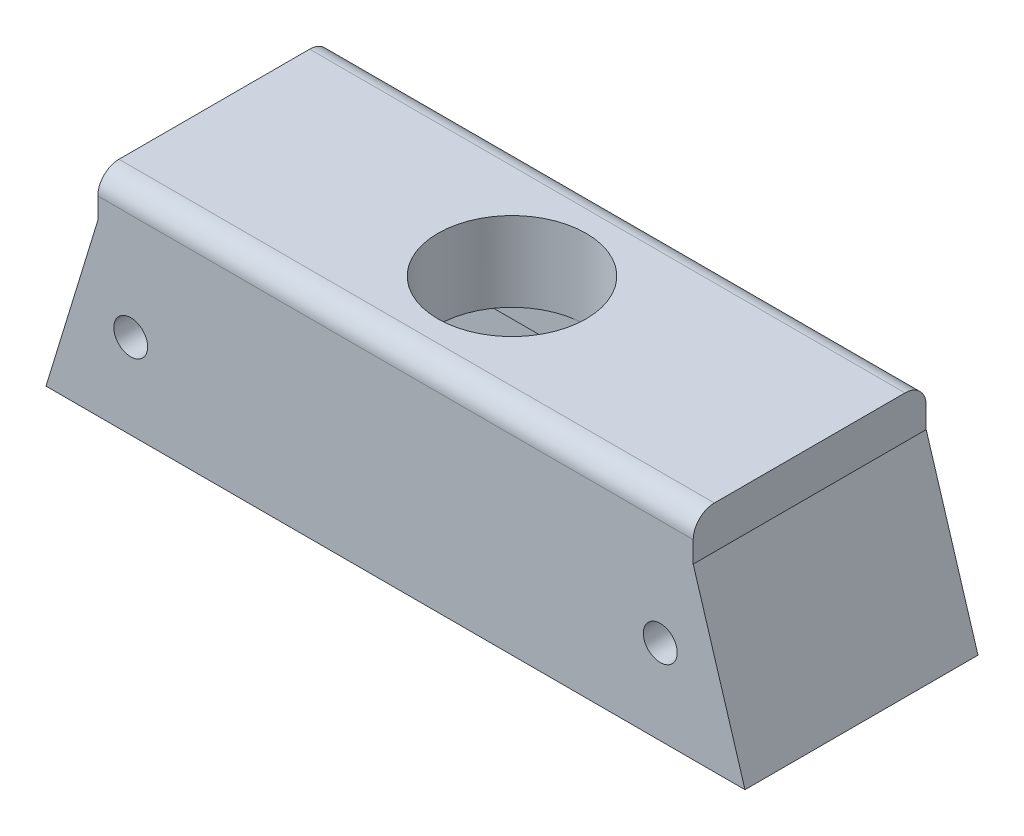
from build123d import *

# Parameters (mm, degrees)
SKETCH1_W                      = 33
SKETCH1_H                      = 11
SKETCH1_W_2                    = 30
SKETCH1_H_2                    = 8
BOSS_EXTRUDE1_DEPTH            = 8
SKETCH3_R                      = 0.8
CUT_EXTRUDE3_DEPTH             = 22.38340478
CUT_EXTRUDE5_REACH             = 21.144
SKETCH5_R                      = 3.5
CUT_EXTRUDE5_DIRECTION_2_DEPTH = 20.144189719
CUT_EXTRUDE4_DEPTH             = 22.38340478
CUT_EXTRUDE9_START             = -1.5
CUT_EXTRUDE9_DEPTH             = 8
SKETCH9_W                      = 22
SKETCH9_H                      = 8
CUT_EXTRUDE8_DEPTH             = 2.25
BOSS_EXTRUDE8_START            = 2
SKETCH12_W                     = 28.108309096
SKETCH12_H                     = 11
SKETCH12_R                     = 3.5
BOSS_EXTRUDE8_DEPTH            = 2
FILLET1_R                      = 1
CHAMFER1_SIZE                  = 1.5
CHAMFER1_SIZE_2                = 3.369055161
CHAMFER2_SIZE                  = 0.5
CHAMFER2_SIZE2                 = 1.123018387
CHAMFER3_SIZE                  = 0.5
CHAMFER3_SIZE2                 = 1.123018387
BOSS_EXTRUDE9_REACH            = 20.168
HEAT_SHRINK_OFFSET_SCALE_SCALE = 1.03


with BuildPart() as part:
    # Sketch1 → Boss-Extrude1 (new body)
    # profile 1 of 2: a face of its own
    with BuildSketch(Plane(origin=(0, 0, 0), x_dir=(1, 0, 0), z_dir=(0, 1, 0))):
        Rectangle(SKETCH1_W, SKETCH1_H)
        Rectangle(SKETCH1_W_2, SKETCH1_H_2, mode=Mode.SUBTRACT)
    # profile 2 of 2: a face of its own
    with BuildSketch(Plane(origin=(0, 0, 0), x_dir=(1, 0, 0), z_dir=(0, 1, 0))):
        Rectangle(SKETCH1_W_2, SKETCH1_H_2)
    extrude(amount=BOSS_EXTRUDE1_DEPTH)

    # Sketch3 → Cut-Extrude3 (cut, through all)
    with BuildSketch(Plane.XY.offset(5.5)):
        with Locations((-12.5, 4)):
            Circle(SKETCH3_R)
        with Locations((12.5, 4)):
            Circle(SKETCH3_R)
    extrude(amount=-CUT_EXTRUDE3_DEPTH, mode=Mode.SUBTRACT)

    # Sketch5 → Cut-Extrude5 (cut, up to next)
    with BuildSketch(Plane(origin=(0, 8, 0), x_dir=(1, 0, 0), z_dir=(0, 1, 0)), mode=Mode.PRIVATE) as cut_extrude5_sk1:
        with Locations(Location((0, 0, 0), (0, 0, 90))):
            Circle(SKETCH5_R)
    cut_extrude5_tool1 = extrude(cut_extrude5_sk1.sketch, amount=-CUT_EXTRUDE5_REACH, mode=Mode.PRIVATE) & part.part
    add(cut_extrude5_tool1.solids().sort_by_distance((0, 8, 0))[0], mode=Mode.SUBTRACT)

    # Sketch5 → Cut-Extrude5 direction 2 (cut)
    with BuildSketch(Plane(origin=(0, 8, 0), x_dir=(1, 0, 0), z_dir=(0, 1, 0))):
        with Locations(Location((0, 0, 0), (0, 0, 90))):
            Circle(SKETCH5_R)
    extrude(amount=CUT_EXTRUDE5_DIRECTION_2_DEPTH, mode=Mode.SUBTRACT)

    # Sketch4 → Cut-Extrude4 (cut, through all)
    with BuildSketch(Plane.XY.offset(5.5)):
        Polygon((-16.5, 0), (-14.054154548, 8), (-16.5, 8), align=None)
        Polygon((16.5, 0), (14.054154548, 8), (16.5, 8), align=None)
    extrude(amount=-CUT_EXTRUDE4_DEPTH, mode=Mode.SUBTRACT)

    # Sketch14 → Cut-Extrude9 (cut)
    with BuildSketch(Plane.XY.offset(5.5).offset(CUT_EXTRUDE9_START)):
        Polygon((-15, 0), (15, 0), (14.235673296, 2.5), (-14.235673296, 2.5), align=None)
    extrude(amount=-CUT_EXTRUDE9_DEPTH, mode=Mode.SUBTRACT)

    # Sketch9 → Cut-Extrude8 (cut)
    with BuildSketch(Plane.XZ.offset(-2.5)):
        Rectangle(SKETCH9_W, SKETCH9_H)
    extrude(amount=-CUT_EXTRUDE8_DEPTH, mode=Mode.SUBTRACT)

    # Sketch12 → Boss-Extrude8 (add)
    with BuildSketch(Plane(origin=(0, 8, 0), x_dir=(1, 0, 0), z_dir=(0, 1, 0)).offset(BOSS_EXTRUDE8_START)):
        Rectangle(SKETCH12_W, SKETCH12_H)
        with Locations(Location((0, 0, 0), (0, 0, 90))):
            Circle(SKETCH12_R, mode=Mode.SUBTRACT)
    extrude(amount=-BOSS_EXTRUDE8_DEPTH)

    # Fillet1
    fillet1_edges = [part.edges().sort_by_distance(p)[0] for p in [
        (0, 10, 5.5),
        (0, 10, -5.5),
    ]]
    fillet(fillet1_edges, radius=FILLET1_R)

    # Chamfer1
    # the kernel refuses this chamfer: 3.369055161, 1.5 mm, written as the material it takes off along each edge
    with BuildSketch(Plane(origin=(0, 4.75, 0), x_dir=(0, 0, -1), z_dir=(1, 0, 0))) as chamfer1_piece_1_section:
        Polygon((3.5, CHAMFER1_SIZE), (3.5 + CHAMFER1_SIZE_2, 0), (3.5, 0), align=None)
    chamfer1_piece_1 = revolve(axis=Axis((0, 4.75, 0), (0, 1, 0)), mode=Mode.PRIVATE)
    chamfer1_piece_1 = split(chamfer1_piece_1, bisect_by=Plane(origin=(-3.432540166, 6.000877118, 4), z_dir=(0, 0, -1)), keep=Keep.TOP, mode=Mode.PRIVATE)
    chamfer1_piece_1 = split(chamfer1_piece_1, bisect_by=Plane(origin=(-3.432540166, 6.000877118, -4), z_dir=(0, 0, 1)), keep=Keep.TOP, mode=Mode.PRIVATE)
    add(chamfer1_piece_1, mode=Mode.SUBTRACT)

    # Chamfer2
    chamfer2_edges = [part.edges().sort_by_distance(p)[0] for p in [
        (-11, 2.5, 0),
    ]]
    chamfer2_side = [part.faces().sort_by_distance(p)[0] for p in [
        (-11, 3.625, 0),
    ]]
    chamfer(chamfer2_edges, length=CHAMFER2_SIZE, length2=CHAMFER2_SIZE2, reference=chamfer2_side[0])

    # Chamfer3
    chamfer3_edges = [part.edges().sort_by_distance(p)[0] for p in [
        (11, 2.5, 0),
    ]]
    chamfer3_side = [part.faces().sort_by_distance(p)[0] for p in [
        (11, 3.625, 0),
    ]]
    chamfer(chamfer3_edges, length=CHAMFER3_SIZE, length2=CHAMFER3_SIZE2, reference=chamfer3_side[0])

    # Sketch17 → Boss-Extrude9 (add, up to next)
    with BuildSketch(Plane.XZ.offset(-4.75), mode=Mode.PRIVATE) as boss_extrude9_sk1:
        Polygon((5.910492264, -3.5), (0, -3.5), (-5.910492264, -3.5), (-5.910492264, -4), (5.910492264, -4), align=None)
    boss_extrude9_tool1 = extrude(boss_extrude9_sk1.sketch, amount=-BOSS_EXTRUDE9_REACH, mode=Mode.PRIVATE) - part.part
    add(boss_extrude9_tool1.solids().sort_by_distance((0, 4.75, -3.75))[0])


with BuildPart() as part_1:
    # Heat shrink offset scale: scaled about (0, 5.8657217, -0.009275667)
    add(part.part.scale(HEAT_SHRINK_OFFSET_SCALE_SCALE).moved(Location((0, -0.175971651, 0.00027827))))


solid = part_1.part
